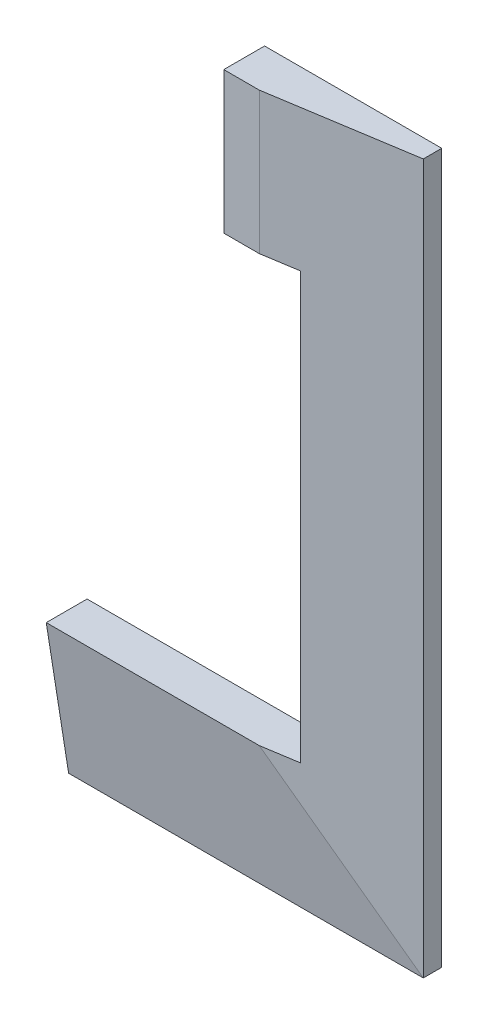
from build123d import *

# Parameters (mm, degrees)
DODANIE_WYCI_GNI_CIE1_DEPTH = 5.2
SZKIC6_W                    = 49.271239353
SZKIC6_H                    = 120
WYTNIJ_WYCI_GNI_CIE1_DEPTH  = 78
WYTNIJ_WYCI_GNI_CIE2_DEPTH  = 5.6
SZKIC9_R                    = 2.424871131
SZKIC9_R_2                  = 1.2
DODANIE_WYCI_GNI_CIE3_DEPTH = 3.8
SZKIC10_W                   = 50
SZKIC10_H                   = 39.9
WYTNIJ_WYCI_GNI_CIE4_DEPTH  = 24


with BuildPart() as part:
    # Szkic2 → Dodanie-wyciągnięcie1 (new body)
    with BuildSketch(Plane.XY):
        Polygon((18.542832418, 83.245366469), (18.542832418, 43.345366469), (-51.457167582, 43.345366469), (-51.457167582, -76.654633531), (18.542832418, -76.654633531), (18.542832418, -116.554633531), (-81.357167582, -116.554633531), (-81.357167582, 83.245366469), align=None)
    extrude(amount=DODANIE_WYCI_GNI_CIE1_DEPTH)

    # Szkic3 → Wyciągnięcie po profilach3 section 0
    with BuildSketch(Plane.XY.offset(11.5)):
        with BuildLine():
            Line((-41.457167582, -76.654633531), (18.542832418, -76.654633531))
            Line((18.542832418, -76.654633531), (18.542832418, 83.245366469))
            Line((18.542832418, 83.245366469), (-41.457167582, 83.245366469))
            Line((-41.457167582, 83.245366469), (-41.457167582, -76.654633531))
        make_face()
    # Szkic5 → Wyciągnięcie po profilach3 section 1
    with BuildSketch(Plane.XY.offset(5.2)):
        with BuildLine():
            Line((-81.357167582, 83.245366469), (18.542832418, 83.245366469))
            Line((18.542832418, 83.245366469), (18.542832418, -116.554633531))
            Line((18.542832418, -116.554633531), (-81.357167582, -116.554633531))
            Line((-81.357167582, -116.554633531), (-81.357167582, 83.245366469))
        make_face()
    loft()

    # Szkic6 → Wytnij-wyciągnięcie1 (cut)
    with BuildSketch(Plane(origin=(-51.457167582, 0, 0), x_dir=(0, 0, -1), z_dir=(1, 0, 0))):
        with Locations((-24.635619677, -16.654633531)):
            Rectangle(SZKIC6_W, SZKIC6_H)
    extrude(amount=WYTNIJ_WYCI_GNI_CIE1_DEPTH, mode=Mode.SUBTRACT)

    # Szkic7 → Wytnij-wyciągnięcie2 (cut)
    with BuildSketch(Plane(origin=(-51.457167582, 0, 0), x_dir=(0, 0, -1), z_dir=(1, 0, 0))):
        Polygon((-5.12, -34.1297624), (-7.22, -35.342197966), (-7.22, -37.767069096), (-5.12, -38.979504662), (-3.02, -37.767069096), (-3.02, -35.342197966), align=None)
        Polygon((-5.12, 5.6702376), (-7.22, 4.457802034), (-7.22, 2.032930904), (-5.12, 0.820495338), (-3.02, 2.032930904), (-3.02, 4.457802034), align=None)
    extrude(amount=-WYTNIJ_WYCI_GNI_CIE2_DEPTH, mode=Mode.SUBTRACT)

    # Szkic9 → Dodanie-wyciągnięcie3 (add)
    # profile 1 of 2: a face of its own
    with BuildSketch(Plane(origin=(-51.457167582, 0, 0), x_dir=(0, 0, -1), z_dir=(1, 0, 0))):
        with Locations((-5.12, 3.245366469)):
            Circle(SZKIC9_R)
        with Locations((-5.12, 3.245366469)):
            Circle(SZKIC9_R_2, mode=Mode.SUBTRACT)
    # profile 2 of 2: a face of its own
    with BuildSketch(Plane(origin=(-51.457167582, 0, 0), x_dir=(0, 0, -1), z_dir=(1, 0, 0))):
        with Locations((-5.12, -36.554633531)):
            Circle(SZKIC9_R)
        with Locations((-5.12, -36.554633531)):
            Circle(SZKIC9_R_2, mode=Mode.SUBTRACT)
    extrude(amount=-DODANIE_WYCI_GNI_CIE3_DEPTH)

    # Szkic10 → Wytnij-wyciągnięcie4 (cut)
    with BuildSketch(Plane.XY.offset(11.5)):
        with Locations((-6.457167582, 63.295366469)):
            Rectangle(SZKIC10_W, SZKIC10_H)
    extrude(amount=-WYTNIJ_WYCI_GNI_CIE4_DEPTH, mode=Mode.SUBTRACT)


with BuildPart() as body_2:
    # Lustro1: mirrored copy
    add(part.part.mirror(Plane(origin=(18.542832418, 83.245366469, 5.2), x_dir=(0, 0, 1), z_dir=(-1, 0, 0))))


with BuildPart() as body_2_1:
    # Obiekt-Przenieś/Kopiuj1: moved
    add(body_2.part.moved(Location((34.890139481, 0, 0))))


solid = body_2_1.part
